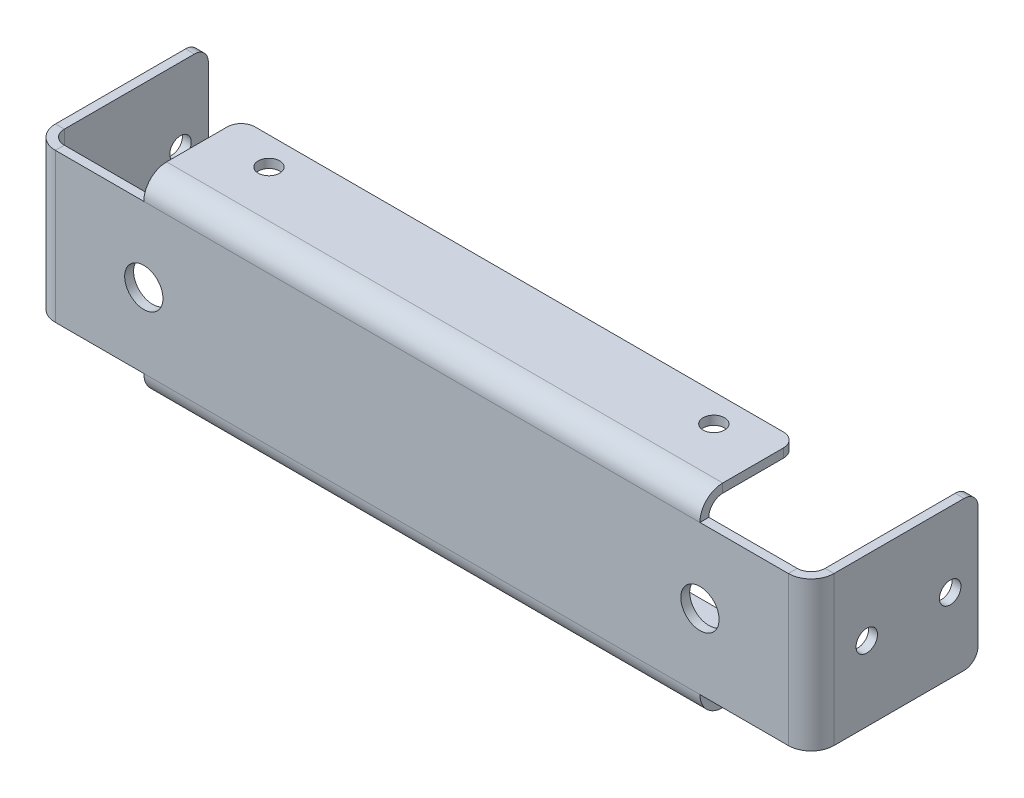
from build123d import *

# Parameters (mm, degrees)
BASE_FLANGE1_DEPTH           = 127
SKETCH6_W                    = 2.032
SKETCH6_H                    = 34.036
BOSS_EXTRUDE1_DEPTH          = 25.4
EDGE_FLANGE1_STRIP_W         = 14.478
EDGE_FLANGE1_STRIP_H         = 2.032
EDGE_FLANGE1_STRIP_CUT_DEPTH = 34.036
EDGE_FLANGE1_DEPTH           = 34.036
SKETCH10_R                   = 2.4511
CUT_EXTRUDE1_DEPTH           = 188.190417757
SKETCH11_R                   = 2.4511
CUT_EXTRUDE2_DEPTH           = 164.257993679
SKETCH12_R                   = 4.3688
CUT_EXTRUDE3_DEPTH           = 164.257993679
FILLET1_R                    = 3.175


# Sheet-metal steps are written as plain solids
with BuildPart() as part:
    # Sketch1 → Base-Flange1 (new body)
    with BuildSketch(Plane(origin=(0, 0, 0), x_dir=(0, 0, -1), z_dir=(1, 0, 0))):
        with BuildLine():
            Line((22.225, 0), (5.207, 0))
            ThreePointArc((5.207, 0), (1.52509499, 1.52509499), (0, 5.207))
            Line((0, 5.207), (0, 39.243))
            ThreePointArc((0, 39.243), (1.52509499, 42.92490501), (5.207, 44.45))
            Line((5.207, 44.45), (22.225, 44.45))
            Line((22.225, 44.45), (22.225, 42.418))
            Line((22.225, 42.418), (5.207, 42.418))
            ThreePointArc((5.207, 42.418), (2.96193597, 41.48806403), (2.032, 39.243))
            Line((2.032, 39.243), (2.032, 5.207))
            ThreePointArc((2.032, 5.207), (2.96193597, 2.96193597), (5.207, 2.032))
            Line((5.207, 2.032), (22.225, 2.032))
            Line((22.225, 2.032), (22.225, 0))
        make_face()
    extrude(amount=BASE_FLANGE1_DEPTH)

    # Sketch6 → Boss-Extrude1 (add)
    with BuildSketch(Plane(origin=(127, 0, 0), x_dir=(0, 0, -1), z_dir=(1, 0, 0))):
        with Locations((1.016, 22.225)):
            Rectangle(SKETCH6_W, SKETCH6_H)
    boss_extrude1 = extrude(amount=BOSS_EXTRUDE1_DEPTH)

    # Edge-Flange1 strip (across the edge) → Edge-Flange1 strip cut (cut)
    with BuildSketch(Plane(origin=(152.4, 39.243, -2.032), x_dir=(-1, 0, 0), z_dir=(0, -1, 0))):
        with Locations((-2.032, -1.016)):
            Rectangle(EDGE_FLANGE1_STRIP_W, EDGE_FLANGE1_STRIP_H)
    edge_flange1_strip_cut = extrude(amount=EDGE_FLANGE1_STRIP_CUT_DEPTH, mode=Mode.SUBTRACT)

    # Edge-Flange1 section (across the edge) → Edge-Flange1 (add)
    with BuildSketch(Plane(origin=(152.4, 39.243, -2.032), x_dir=(-1, 0, 0), z_dir=(0, -1, 0))):
        with BuildLine():
            Line((0, 3.175), (0, 36.068))
            Line((0, 36.068), (2.032, 36.068))
            Line((2.032, 36.068), (2.032, 3.175))
            ThreePointArc((2.032, 3.175), (2.96193597, 0.92993597), (5.207, 0))
            Line((5.207, 0), (5.207, -2.032))
            ThreePointArc((5.207, -2.032), (1.52509499, -0.50690501), (0, 3.175))
        make_face()
    edge_flange1 = extrude(amount=EDGE_FLANGE1_DEPTH)

    # Mirror1: Boss-Extrude1, Edge-Flange1 strip cut, Edge-Flange1 across plane
    add(boss_extrude1.mirror(Plane(origin=(63.5, 0, 0), x_dir=(0, 0, 1), z_dir=(1, 0, 0))))
    add(edge_flange1_strip_cut.mirror(Plane(origin=(63.5, 0, 0), x_dir=(0, 0, 1), z_dir=(1, 0, 0))), mode=Mode.SUBTRACT)
    add(edge_flange1.mirror(Plane(origin=(63.5, 0, 0), x_dir=(0, 0, 1), z_dir=(1, 0, 0))))

    # Sketch10 → Cut-Extrude1 (cut, through all)
    with BuildSketch(Plane(origin=(152.4, 0, 0), x_dir=(0, 0, -1), z_dir=(1, 0, 0))):
        with Locations((12.7, 22.225)):
            Circle(SKETCH10_R)
        with Locations((31.75, 22.225)):
            Circle(SKETCH10_R)
    extrude(amount=-CUT_EXTRUDE1_DEPTH, mode=Mode.SUBTRACT)

    # Sketch11 → Cut-Extrude2 (cut, through all)
    with BuildSketch(Plane(origin=(0, 44.45, 0), x_dir=(1, 0, 0), z_dir=(0, 1, 0))):
        with Locations(Location((12.7, 15.875, 0), (0, 0, 270))):
            Circle(SKETCH11_R)
        with Locations(Location((114.3, 15.875, 0), (0, 0, 270))):
            Circle(SKETCH11_R)
    extrude(amount=-CUT_EXTRUDE2_DEPTH, mode=Mode.SUBTRACT)

    # Sketch12 → Cut-Extrude3 (cut, through all)
    with BuildSketch(Plane.XY):
        with Locations((0, 22.225)):
            Circle(SKETCH12_R)
        with Locations((127, 22.225)):
            Circle(SKETCH12_R)
    extrude(amount=-CUT_EXTRUDE3_DEPTH, mode=Mode.SUBTRACT)

    # Fillet1
    fillet1_edges = [part.edges().sort_by_distance(p)[0] for p in [
        (-24.384, 5.207, -38.1),
        (0, 1.016, -22.225),
        (-24.384, 39.243, -38.1),
        (0, 43.434, -22.225),
        (127, 1.016, -22.225),
        (151.384, 39.243, -38.1),
        (151.384, 5.207, -38.1),
        (127, 43.434, -22.225),
    ]]
    fillet(fillet1_edges, radius=FILLET1_R)


solid = part.part
